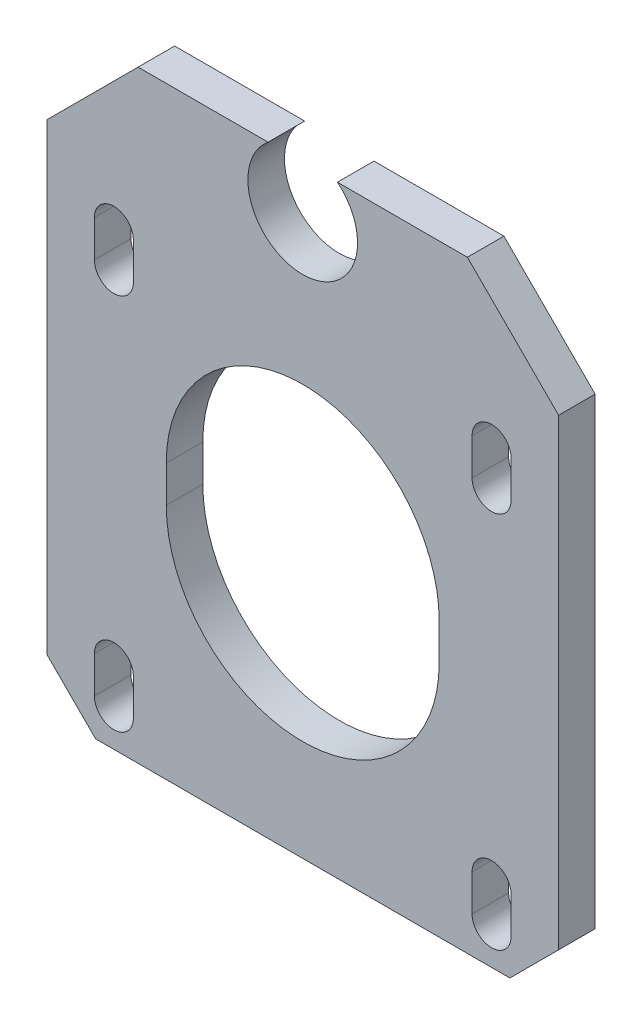
from build123d import *

# Parameters (mm, degrees)
BOSS_EXTRUDE1_DEPTH = 3
CHAMFER1_SIZE       = 4


with BuildPart() as part:
    # Sketch1 → Boss-Extrude1 (new body)
    with BuildSketch(Plane.XY):
        with BuildLine():
            Line((-21, -21), (21, -21))
            Line((21, -21), (21, 21))
            Line((21, 21), (13.513592999, 28.486407001))
            Line((13.513592999, 28.486407001), (2.845165412, 28.486407001))
            ThreePointArc((2.845165412, 28.486407001), (0, 20.5), (-2.845165412, 28.486407001))
            Line((-2.845165412, 28.486407001), (-13.513592999, 28.486407001))
            Line((-13.513592999, 28.486407001), (-21, 21))
            Line((-21, 21), (-21, -21))
        make_face()
        with BuildLine():
            Line((-11.2, 1.5), (-11.2, -1.5))
            ThreePointArc((-11.2, -1.5), (0, -12.7), (11.2, -1.5))
            Line((11.2, -1.5), (11.2, 1.5))
            ThreePointArc((11.2, 1.5), (0, 12.7), (-11.2, 1.5))
        make_face(mode=Mode.SUBTRACT)
        with BuildLine():
            Line((-13.9, -15), (-13.9, -18))
            ThreePointArc((-13.9, -18), (-15.5, -19.6), (-17.1, -18))
            Line((-17.1, -18), (-17.1, -15))
            ThreePointArc((-17.1, -15), (-15.5, -13.4), (-13.9, -15))
        make_face(mode=Mode.SUBTRACT)
        with BuildLine():
            Line((-13.9, 16), (-13.9, 13))
            ThreePointArc((-13.9, 13), (-15.5, 11.4), (-17.1, 13))
            Line((-17.1, 13), (-17.1, 16))
            ThreePointArc((-17.1, 16), (-15.5, 17.6), (-13.9, 16))
        make_face(mode=Mode.SUBTRACT)
        with BuildLine():
            Line((13.9, -15), (13.9, -18))
            ThreePointArc((13.9, -18), (15.5, -19.6), (17.1, -18))
            Line((17.1, -18), (17.1, -15))
            ThreePointArc((17.1, -15), (15.5, -13.4), (13.9, -15))
        make_face(mode=Mode.SUBTRACT)
        with BuildLine():
            Line((13.9, 16), (13.9, 13))
            ThreePointArc((13.9, 13), (15.5, 11.4), (17.1, 13))
            Line((17.1, 13), (17.1, 16))
            ThreePointArc((17.1, 16), (15.5, 17.6), (13.9, 16))
        make_face(mode=Mode.SUBTRACT)
    extrude(amount=BOSS_EXTRUDE1_DEPTH)

    # Chamfer1
    chamfer1_edges = [part.edges().sort_by_distance(p)[0] for p in [
        (-21, -21, 1.5),
        (21, -21, 1.5),
    ]]
    chamfer(chamfer1_edges, length=CHAMFER1_SIZE)


solid = part.part
